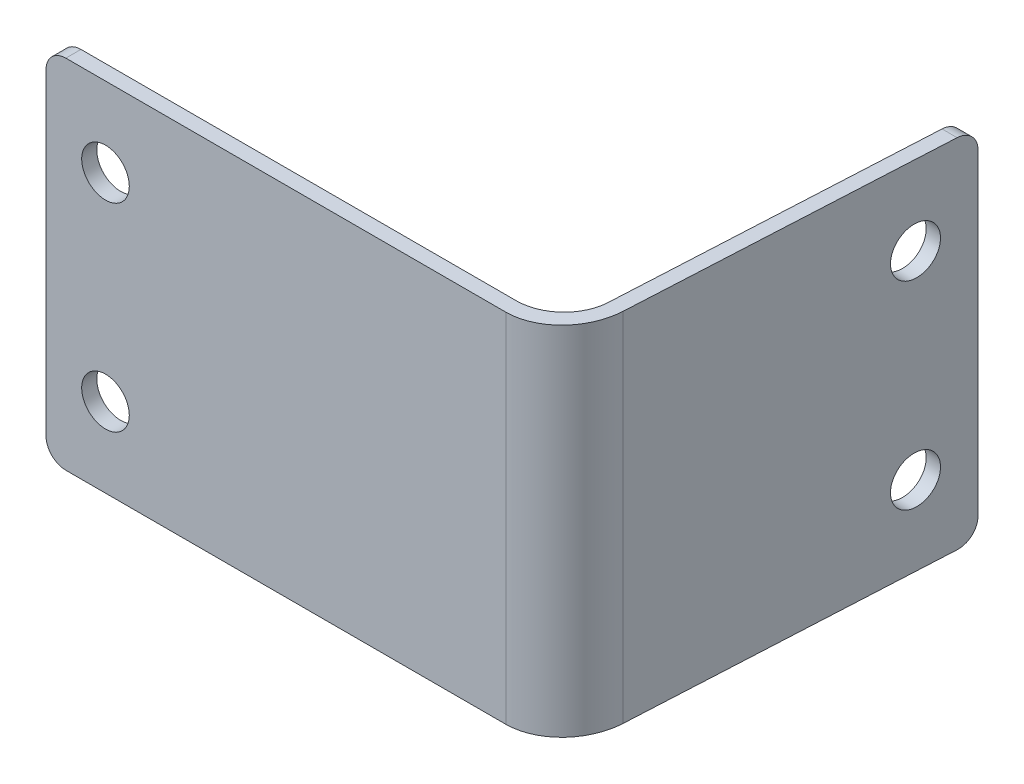
from build123d import *

# Parameters (mm, degrees)
BOSS_EXTRUDE1_DEPTH     = 90
CUT_EXTRUDE1_DEPTH      = 221.737400712
CUT_EXTRUDE1_DEPTH_BACK = 221.737400712
SKETCH3_R               = 6
CUT_EXTRUDE2_DEPTH      = 203.489832762
CUT_EXTRUDE2_DEPTH_BACK = 203.489832762
SKETCH4_R               = 6
FILLET1_R               = 5
BOSS_EXTRUDE2_DEPTH     = 90
SAVE_BODIES1_DEPTH      = 90


# Read off the part's stored shape, not the designer's step: Save Bodies1
with BuildPart() as part:
    # Sketch1 → Boss-Extrude1 (new body)
    with BuildSketch(Plane(origin=(0, 0, 0), x_dir=(1, 0, 0), z_dir=(0, 1, 0))):
        with BuildLine():
            Line((154.751233709, -116.19), (40, -116.19))
            Line((40, -116.19), (40, -120))
            Line((40, -120), (155.92492368, -120))
            add(Edge.make_bspline(
                [(155.92492368, -120), (169.759222072, -120), (170.545338761, -105)],
                knots=[0, 0, 0, 1.513941954, 1.513941954, 1.513941954], degree=2, weights=[1, 0.726919441, 1]))
            Line((170.545338761, -105), (175, -20))
            Line((175, -20), (171.19, -20))
            Line((171.19, -20), (166.735338761, -105))
            add(Edge.make_bspline(
                [(154.751233709, -116.19), (166.148895711, -116.19), (166.735338761, -105)],
                knots=[1.570796327, 1.570796327, 1.570796327, 3.090116999, 3.090116999, 3.090116999], degree=2, weights=[1, 0.725069971, 1]))
        make_face()
    extrude(amount=BOSS_EXTRUDE1_DEPTH)

    # Sketch3 → Cut-Extrude1 (cut, two sides: drawn at the far end of the back side and taken through both)
    with BuildSketch(Plane.XY.offset(120).offset(-CUT_EXTRUDE1_DEPTH_BACK)):
        with Locations((55, 70)):
            Circle(SKETCH3_R)
        with Locations((55, 20)):
            Circle(SKETCH3_R)
    extrude(amount=CUT_EXTRUDE1_DEPTH + CUT_EXTRUDE1_DEPTH_BACK, mode=Mode.SUBTRACT)

    # Sketch4 → Cut-Extrude2 (cut, two sides: drawn at the far end of the back side and taken through both)
    with BuildSketch(Plane(origin=(176.046719125, 0, 0.027409305), x_dir=(0.052335956242940504, 0, -0.9986295347545742), z_dir=(0.9986295347545742, 0, 0.052335956242940504)).offset(-CUT_EXTRUDE2_DEPTH_BACK)):
        with Locations((-35, 70)):
            Circle(SKETCH4_R)
        with Locations((-35, 20)):
            Circle(SKETCH4_R)
    extrude(amount=CUT_EXTRUDE2_DEPTH + CUT_EXTRUDE2_DEPTH_BACK, mode=Mode.SUBTRACT)

    # Fillet1
    fillet1_edges = [part.edges().sort_by_distance(p)[0] for p in [
        (173.095, 0, 20),
        (173.095, 90, 20),
        (40, 90, 118.095),
        (40, 0, 118.095),
    ]]
    fillet(fillet1_edges, radius=FILLET1_R)


with BuildPart() as body_2:
    # Sketch5 → Boss-Extrude2 (new body)
    with BuildSketch(Plane(origin=(0, 0, 0), x_dir=(1, 0, 0), z_dir=(0, 1, 0))):
        with BuildLine():
            Line((154.751233709, -116.19), (40, -116.19))
            Line((40, -116.19), (40, -96.19))
            Line((40, -96.19), (128.217759962, -96.19))
            ThreePointArc((128.217759962, -96.19), (141.984851476, -90.69748742), (148.190350657, -77.236719125))
            Line((148.190350657, -77.236719125), (151.19, -20))
            Line((151.19, -20), (171.19, -20))
            Line((171.19, -20), (166.735338761, -105))
            add(Edge.make_bspline(
                [(154.751233709, -116.19), (166.148895711, -116.19), (166.735338761, -105)],
                knots=[1.570796327, 1.570796327, 1.570796327, 3.090116999, 3.090116999, 3.090116999], degree=2, weights=[1, 0.725069971, 1]))
        make_face()
    extrude(amount=BOSS_EXTRUDE2_DEPTH)

    # Save Bodies1 outline → Save Bodies1 (cut)
    with BuildSketch(Plane(origin=(0, 0, 0), x_dir=(1, 0, 0), z_dir=(0, 1, 0))):
        with BuildLine():
            Line((171.19, -20), (151.19, -20))
            Line((151.19, -20), (148.190350657, -77.236719125))
            ThreePointArc((148.190350657, -77.236719125), (141.984851476, -90.69748742), (128.217759962, -96.19))
            Line((128.217759962, -96.19), (40, -96.19))
            Line((40, -96.19), (40, -116.19))
            Line((40, -116.19), (154.751233709, -116.19))
            add(Edge.make_bspline(
                [(166.735338761, -105), (166.148895711, -116.19), (154.751233709, -116.19)],
                knots=[3.193068309, 3.193068309, 3.193068309, 4.71238898, 4.71238898, 4.71238898], degree=2, weights=[1, 0.725069971, 1]))
            Line((166.735338761, -105), (171.19, -20))
        make_face()
    extrude(amount=SAVE_BODIES1_DEPTH, mode=Mode.SUBTRACT)


solid = part.part
